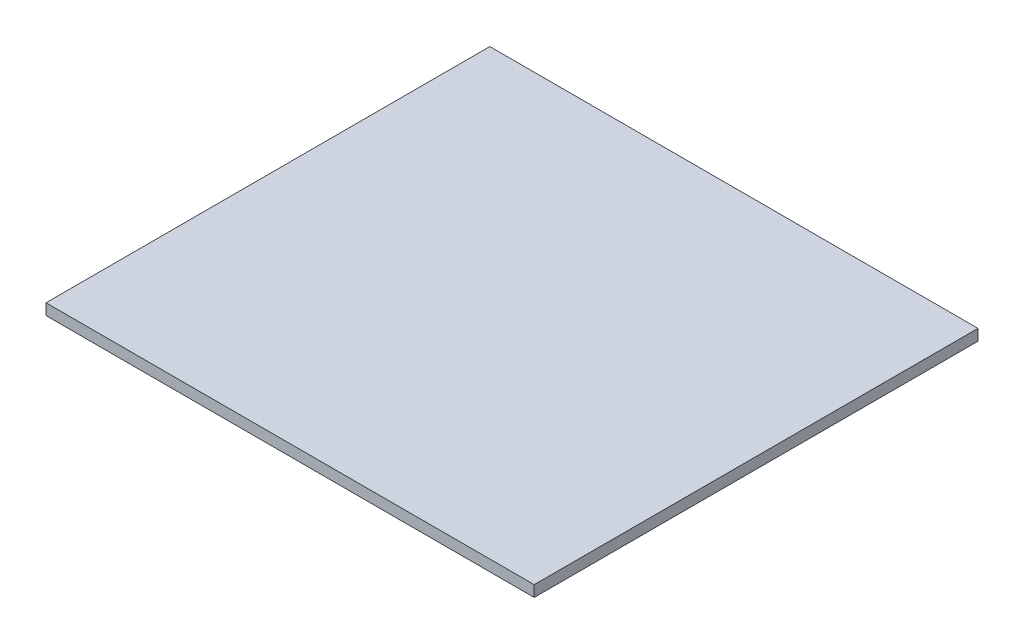
from build123d import *

# Parameters (mm, degrees)
SKETCH1_W           = 220
SKETCH1_H           = 200
BOSS_EXTRUDE1_DEPTH = 5


with BuildPart() as part:
    # Sketch1 → Boss-Extrude1 (new body)
    with BuildSketch(Plane(origin=(0, 0, 0), x_dir=(1, 0, 0), z_dir=(0, 1, 0))):
        with Locations((110, 100)):
            Rectangle(SKETCH1_W, SKETCH1_H)
    extrude(amount=BOSS_EXTRUDE1_DEPTH)


solid = part.part
